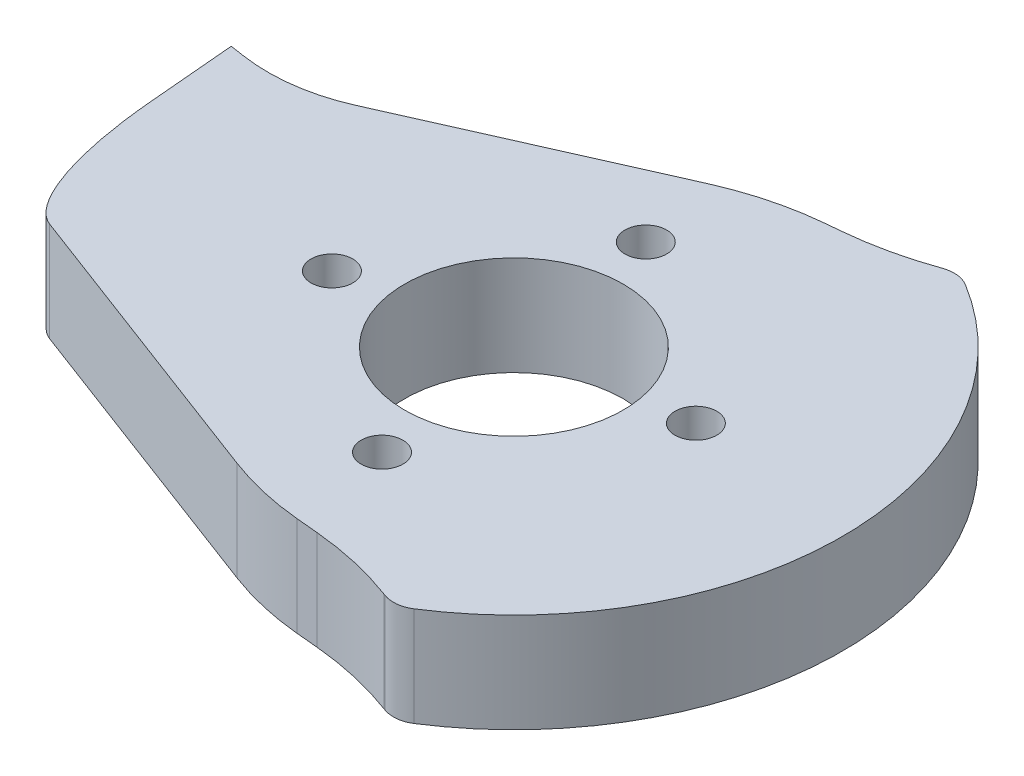
from build123d import *

# Parameters (mm, degrees)
SKETCH1_R           = 11
BOSS_EXTRUDE1_DEPTH = 10
SKETCH2_R           = 2.1
CUT_EXTRUDE1_DEPTH  = 10
FILLET2_R           = 18
FILLET3_R           = 30
FILLET4_R           = 34
FILLET7_R           = 3


with BuildPart() as part:
    # Sketch1 → Boss-Extrude1 (new body)
    with BuildSketch(Plane(origin=(0, 0, 0), x_dir=(1, 0, 0), z_dir=(0, 1, 0))):
        with BuildLine():
            Line((-43.837879331, 11.61), (-37.199459056, 10.61))
            Line((-37.199459056, 10.61), (-3.38, 25.61))
            Line((-3.38, 25.61), (7.395945787, 26.61))
            Line((7.395945787, 26.61), (12.62, 28.528895207))
            ThreePointArc((12.62, 28.528895207), (29.66875295, -0.102896427), (13.12, -29.026558802))
            Line((13.12, -29.026558802), (7.395945787, -26.89))
            Line((7.395945787, -26.89), (-3.38, -25.89))
            Line((-3.38, -25.89), (-41.837879331, -11.39))
            Line((-41.837879331, -11.39), (-43.837879331, 11.61))
        make_face()
        with Locations(Location((-3.38, -0.39, 0), (0, 0, 270))):
            Circle(SKETCH1_R, mode=Mode.SUBTRACT)
    extrude(amount=BOSS_EXTRUDE1_DEPTH)

    # Sketch2 → Cut-Extrude1 (cut)
    with BuildSketch(Plane(origin=(0, 10, 0), x_dir=(1, 0, 0), z_dir=(0, 1, 0))):
        with Locations(Location((12.42, 2.131904043, 0), (0, 0, 270))):
            Circle(SKETCH2_R)
        with Locations(Location((-0.858095957, -16.19, 0), (0, 0, 270))):
            Circle(SKETCH2_R)
        with Locations(Location((-19.18, -2.911904043, 0), (0, 0, 270))):
            Circle(SKETCH2_R)
        with Locations(Location((-5.901904043, 15.41, 0), (0, 0, 270))):
            Circle(SKETCH2_R)
    extrude(amount=-CUT_EXTRUDE1_DEPTH, mode=Mode.SUBTRACT)

    # Fillet1
    # an asymmetric fillet: 18, 12 mm, written as the material it takes off along each edge
    with BuildSketch(Plane(origin=(-41.837879331, -35.518473591, 11.39), x_dir=(0.9357013977145019, 0, 0.3527929907397927), z_dir=(0, 1, 0))) as fillet1_piece_1:
        with BuildLine():
            Bezier((4.674389222, 0), (0, 0), (-6.145067451, 12.809686203), weights=[1, 0.846323269, 1])
            Line((-6.145067451, 12.809686203), (0, 0))
            Line((0, 0), (4.674389222, 0))
        make_face()
    extrude(amount=81.036947182, mode=Mode.SUBTRACT)

    # Fillet2
    fillet2_edges = [part.edges().sort_by_distance(p)[0] for p in [
        (-37.199459056, 5, -10.61),
    ]]
    fillet(fillet2_edges, radius=FILLET2_R)

    # Fillet3
    fillet3_edges = [part.edges().sort_by_distance(p)[0] for p in [
        (-3.38, 5, -25.61),
        (-3.38, 5, 25.89),
    ]]
    fillet(fillet3_edges, radius=FILLET3_R)

    # Fillet4
    fillet4_edges = [part.edges().sort_by_distance(p)[0] for p in [
        (7.395945787, 5, -26.61),
        (7.395945787, 5, 26.89),
    ]]
    fillet(fillet4_edges, radius=FILLET4_R)

    # Fillet7
    fillet7_edges = [part.edges().sort_by_distance(p)[0] for p in [
        (12.62, 5, -28.528895207),
        (13.12, 5, 29.026558802),
    ]]
    fillet(fillet7_edges, radius=FILLET7_R)


solid = part.part
